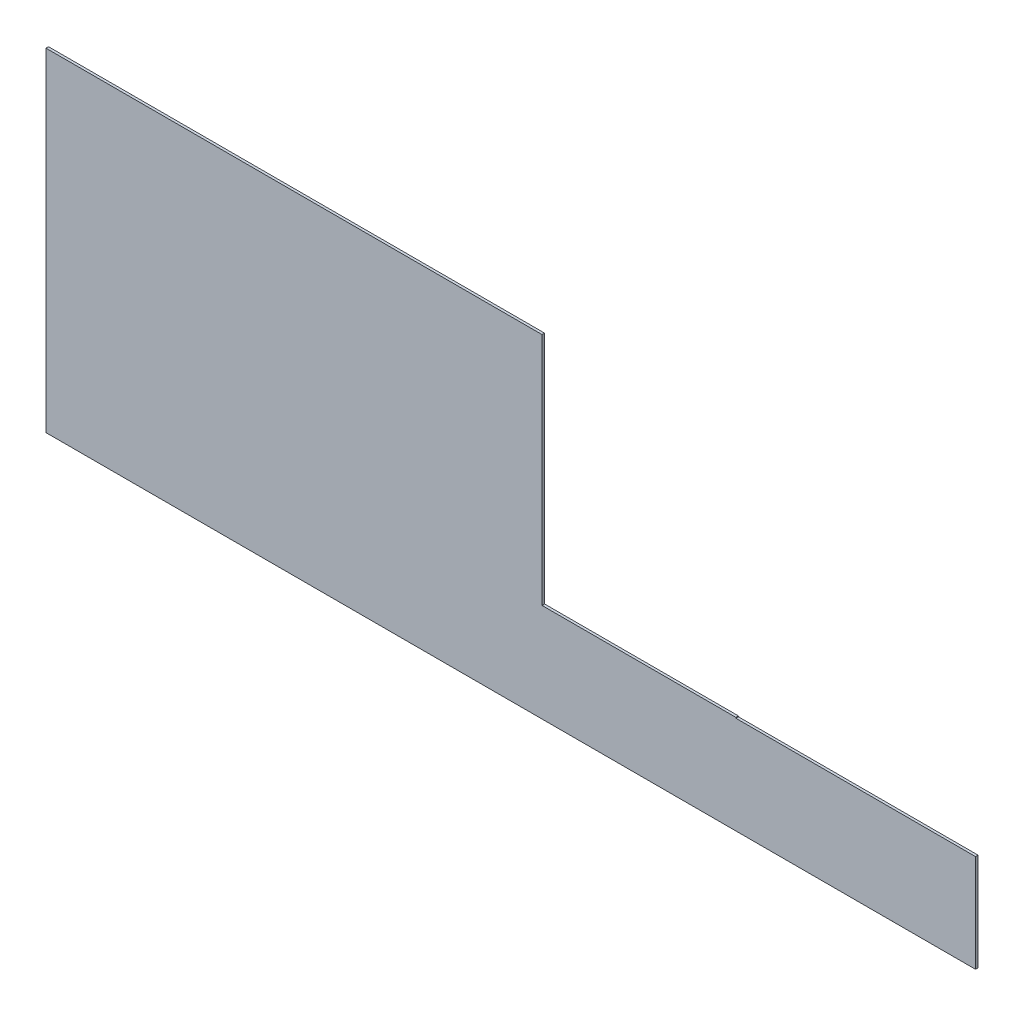
from build123d import *

# Parameters (mm, degrees)
TABAN_FLAN_1_DEPTH         = 10
KES_EKSTR_ZYON1_DEPTH      = 6514.086825769
KES_EKSTR_ZYON1_DEPTH_BACK = 6514.086825769
IZIM2_W                    = 605
IZIM2_H                    = 2510
KES_EKSTR_ZYON2_DEPTH      = 5960.381259829
KES_EKSTR_ZYON2_DEPTH_BACK = 5960.381259829
IZIM3_W                    = 1345
IZIM3_H                    = 1305
KES_EKSTR_ZYON3_DEPTH      = 5960.381259829
KES_EKSTR_ZYON3_DEPTH_BACK = 5960.381259829
IZIM4_W                    = 3
IZIM4_H                    = 385
KES_EKSTR_ZYON4_DEPTH      = 5960.381259829
KES_EKSTR_ZYON4_DEPTH_BACK = 5960.381259829
IZIM6_W                    = 1737
IZIM6_H                    = 385
IZIM6_W_2                  = 2720
IZIM6_H_2                  = 857
KES_EKSTR_ZYON5_DEPTH      = 5653.126502477
KES_EKSTR_ZYON5_DEPTH_BACK = 5653.126502477
IZIM7_W                    = 764
IZIM7_H                    = 925


# Sheet-metal steps are written as plain solids
with BuildPart() as part:
    # Çizim1 → Taban-Flanş1 (new body)
    with BuildSketch(Plane.XY):
        Polygon((0, 0), (0, 1755), (-2685, 1755), (-2685, 2510), (-6010, 2510), (-6010, 0), align=None)
    extrude(amount=-TABAN_FLAN_1_DEPTH)

    # Çizim2 → Kes-Ekstrüzyon1 (cut, two sides: drawn at the far end of the back side and taken through both)
    with BuildSketch(Plane.XY.offset(-KES_EKSTR_ZYON1_DEPTH_BACK)):
        with Locations((-5707.5, 1255)):
            Rectangle(IZIM2_W, IZIM2_H)
    extrude(amount=KES_EKSTR_ZYON1_DEPTH + KES_EKSTR_ZYON1_DEPTH_BACK, mode=Mode.SUBTRACT)

    # Çizim3 → Kes-Ekstrüzyon2 (cut, two sides: drawn at the far end of the back side and taken through both)
    with BuildSketch(Plane.XY.offset(-KES_EKSTR_ZYON2_DEPTH_BACK)):
        with Locations((-672.5, 1102.5)):
            Rectangle(IZIM3_W, IZIM3_H)
    extrude(amount=KES_EKSTR_ZYON2_DEPTH + KES_EKSTR_ZYON2_DEPTH_BACK, mode=Mode.SUBTRACT)

    # Çizim4 → Kes-Ekstrüzyon3 (cut, two sides: drawn at the far end of the back side and taken through both)
    with BuildSketch(Plane.XY.offset(-KES_EKSTR_ZYON3_DEPTH_BACK)):
        Polygon((-1345, 1755), (-2685, 1755), (-2685, 385), (-1345, 385), (-1345, 450), align=None)
        with Locations((-1.5, 192.5)):
            Rectangle(IZIM4_W, IZIM4_H)
        Polygon((0, 450), (-1345, 450), (-1345, 385), (-3, 385), (0, 385), align=None)
    extrude(amount=KES_EKSTR_ZYON3_DEPTH + KES_EKSTR_ZYON3_DEPTH_BACK, mode=Mode.SUBTRACT)

    # Çizim6 → Kes-Ekstrüzyon4 (cut, two sides: drawn at the far end of the back side and taken through both)
    with BuildSketch(Plane.XY.offset(-KES_EKSTR_ZYON4_DEPTH_BACK)):
        with Locations((-871.5, 192.5)):
            Rectangle(IZIM6_W, IZIM6_H)
        with Locations((-4045, 2081.5)):
            Rectangle(IZIM6_W_2, IZIM6_H_2)
    extrude(amount=KES_EKSTR_ZYON4_DEPTH + KES_EKSTR_ZYON4_DEPTH_BACK, mode=Mode.SUBTRACT)

    # Çizim7 → Kes-Ekstrüzyon5 (cut, two sides: drawn at the far end of the back side and taken through both)
    with BuildSketch(Plane.XY.offset(-KES_EKSTR_ZYON5_DEPTH_BACK)):
        with Locations((-3067, 850.5)):
            Rectangle(IZIM7_W, IZIM7_H)
        Polygon((-2685, 1653), (-5405, 1653), (-5405, 1313), (-3449, 1313), (-2685, 1313), align=None)
    extrude(amount=KES_EKSTR_ZYON5_DEPTH + KES_EKSTR_ZYON5_DEPTH_BACK, mode=Mode.SUBTRACT)


solid = part.part
